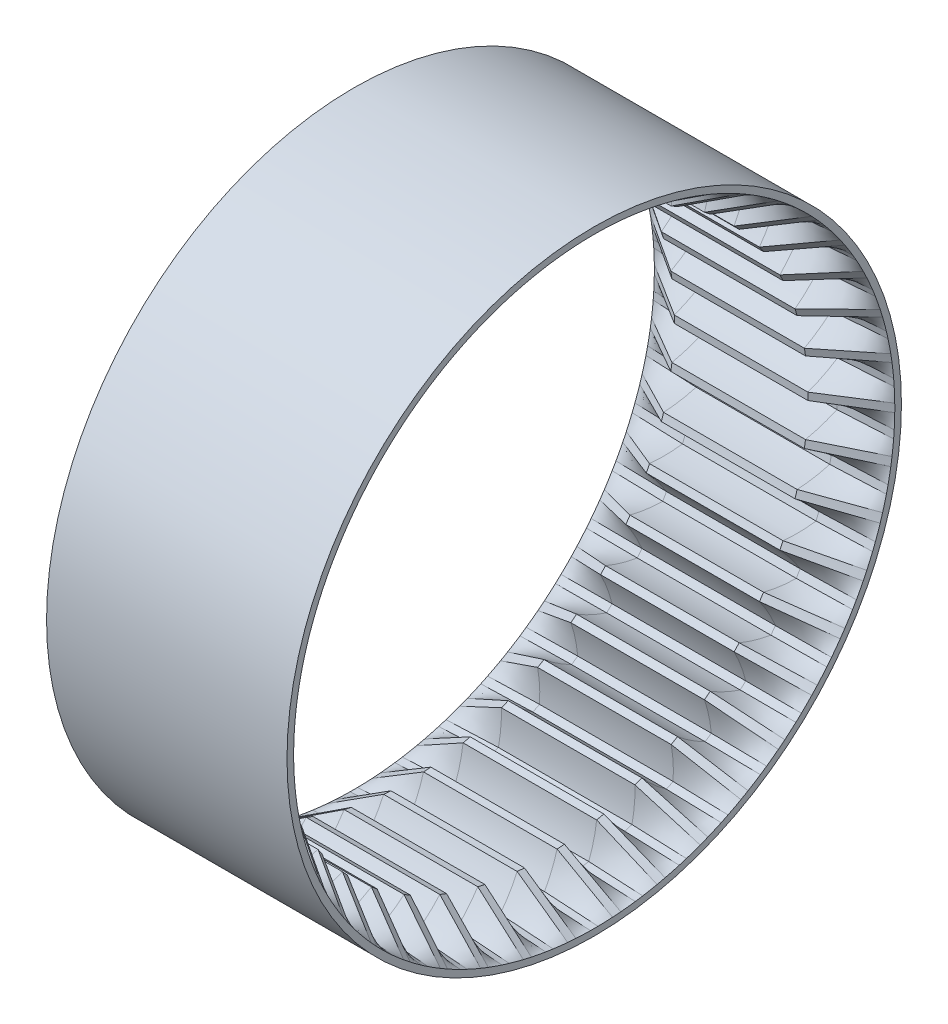
from build123d import *

# Parameters (mm, degrees)
INTERNAL_START                  = -31.817093457
INTERNAL_SPUR_GEAR_AM_OUTLINE_R = 11.5
INTERNAL_SPUR_GEAR_AM_DEPTH     = 5
SKETCH1_R                       = 11.5
SKETCH2_R                       = 11.5
SKETCH2_4_R                     = 11.25


# Read off the part's stored shape, not the designer's step: internal spur gear_am
with BuildPart() as part:
    # internal spur gear_am outline → internal spur gear_am (new body)
    with BuildSketch(Plane.YZ.offset(INTERNAL_START)):
        with Locations((-14.172206763, 26.417834689)):
            Circle(INTERNAL_SPUR_GEAR_AM_OUTLINE_R)
        with BuildLine():
            ThreePointArc((-3.04709591, 26.277177283), (-3.605096525, 26.008397418), (-4.190867754, 25.807202565))
            ThreePointArc((-4.190867754, 25.807202565), (-4.200168791, 25.670533753), (-4.211341069, 25.534005171))
            ThreePointArc((-4.211341069, 25.534005171), (-3.662098957, 25.247752827), (-3.150390308, 24.898809335))
            ThreePointArc((-3.150390308, 24.898809335), (-3.170474991, 24.759590436), (-3.192318105, 24.620636577))
            ThreePointArc((-3.192318105, 24.620636577), (-3.784145874, 24.438024437), (-4.39336106, 24.326381436))
            ThreePointArc((-4.39336106, 24.326381436), (-4.422927641, 24.192625349), (-4.454323663, 24.059286821))
            ThreePointArc((-4.454323663, 24.059286821), (-3.953879829, 23.69437139), (-3.499893872, 23.273059091))
            ThreePointArc((-3.499893872, 23.273059091), (-3.540503726, 23.138388618), (-3.582812869, 23.004242307))
            ThreePointArc((-3.582812869, 23.004242307), (-4.195247338, 22.911877145), (-4.814297619, 22.892279916))
            ThreePointArc((-4.814297619, 22.892279916), (-4.863469277, 22.764424445), (-4.914387707, 22.637254532))
            ThreePointArc((-4.914387707, 22.637254532), (-4.47392124, 22.201827622), (-4.087799271, 21.717557937))
            ThreePointArc((-4.087799271, 21.717557937), (-4.148027139, 21.590444207), (-4.209857194, 21.46410205))
            ThreePointArc((-4.209857194, 21.46410205), (-4.829217589, 21.464047152), (-5.444274405, 21.536933465))
            ThreePointArc((-5.444274405, 21.536933465), (-5.511952725, 21.417834689), (-5.581256131, 21.299674157))
            ThreePointArc((-5.581256131, 21.299674157), (-5.210606324, 20.803462485), (-4.90097367, 20.2670532))
            ThreePointArc((-4.90097367, 20.2670532), (-4.97947416, 20.150335723), (-5.059443946, 20.034619995))
            ThreePointArc((-5.059443946, 20.034619995), (-5.671894779, 20.126876587), (-6.269218778, 20.290618281))
            ThreePointArc((-6.269218778, 20.290618281), (-6.353891939, 20.18293667), (-6.440032196, 20.07642503))
            ThreePointArc((-6.440032196, 20.07642503), (-6.147478753, 19.530513146), (-5.921252095, 18.953946756))
            ThreePointArc((-5.921252095, 18.953946756), (-6.016271637, 18.850232808), (-6.112594761, 18.747728407))
            ThreePointArc((-6.112594761, 18.747728407), (-6.704454893, 18.93023563), (-7.270702843, 19.181174987))
            ThreePointArc((-7.270702843, 19.181174987), (-7.370479386, 19.087315971), (-7.471532264, 18.994832517))
            ThreePointArc((-7.471532264, 18.994832517), (-7.263610346, 18.411415189), (-7.125843214, 17.807571236))
            ThreePointArc((-7.125843214, 17.807571236), (-7.235259228, 17.719177615), (-7.34578399, 17.63217432))
            ThreePointArc((-7.34578399, 17.63217432), (-7.903832243, 17.900855263), (-8.426355101, 18.233386713))
            ThreePointArc((-8.426355101, 18.233386713), (-8.539006183, 18.155446946), (-8.652714327, 18.079057605))
            ThreePointArc((-8.652714327, 18.079057605), (-8.534068566, 17.471167413), (-8.48783845, 16.853534773))
            ThreePointArc((-8.48783845, 16.853534773), (-8.609206763, 16.782436046), (-8.731464223, 16.712877367))
            ThreePointArc((-8.731464223, 16.712877367), (-9.243234722, 17.061730142), (-9.710360191, 17.468425481))
            ThreePointArc((-9.710360191, 17.468425481), (-9.833369372, 17.40814601), (-9.957192731, 17.349557195))
            ThreePointArc((-9.957192731, 17.349557195), (-9.930473477, 16.730773401), (-9.976813081, 16.113148966))
            ThreePointArc((-9.976813081, 16.113148966), (-10.107422526, 16.060933362), (-10.238681654, 16.010373124))
            ThreePointArc((-10.238681654, 16.010373124), (-10.692742292, 16.431604937), (-11.094035559, 16.903379264))
            ThreePointArc((-11.094035559, 16.903379264), (-11.224655019, 16.862106631), (-11.355827583, 16.822627119))
            ThreePointArc((-11.355827583, 16.822627119), (-11.4216317, 16.20677233), (-11.559505875, 15.602952809))
            ThreePointArc((-11.559505875, 15.602952809), (-11.696438852, 15.570786738), (-11.833767537, 15.540354375))
            ThreePointArc((-11.833767537, 15.540354375), (-12.219975348, 16.024555602), (-12.546472187, 16.550870258))
            ThreePointArc((-12.546472187, 16.550870258), (-12.681784102, 16.529526427), (-12.817375692, 16.510038124))
            ThreePointArc((-12.817375692, 16.510038124), (-12.974233224, 15.910869519), (-13.200562089, 15.334343243))
            ThreePointArc((-13.200562089, 15.334343243), (-13.340759742, 15.322945241), (-13.481090287, 15.313320561))
            ThreePointArc((-13.481090287, 15.313320561), (-13.790818028, 15.849674948), (-14.035225038, 16.418772933))
            ThreePointArc((-14.035225038, 16.418772933), (-14.172206764, 16.417834689), (-14.309188489, 16.418772933))
            ThreePointArc((-14.309188489, 16.418772933), (-14.553595499, 15.849674949), (-14.863323239, 15.313320561))
            ThreePointArc((-14.863323239, 15.313320561), (-15.003653784, 15.322945241), (-15.143851437, 15.334343243))
            ThreePointArc((-15.143851437, 15.334343243), (-15.370180302, 15.910869519), (-15.527037834, 16.510038124))
            ThreePointArc((-15.527037834, 16.510038124), (-15.662629425, 16.529526427), (-15.79794134, 16.550870258))
            ThreePointArc((-15.79794134, 16.550870258), (-16.124438179, 16.024555602), (-16.51064599, 15.540354375))
            ThreePointArc((-16.51064599, 15.540354375), (-16.647974674, 15.570786738), (-16.784907651, 15.602952809))
            ThreePointArc((-16.784907651, 15.602952809), (-16.922781827, 16.20677233), (-16.988585943, 16.822627119))
            ThreePointArc((-16.988585943, 16.822627119), (-17.119758507, 16.862106631), (-17.250377967, 16.903379264))
            ThreePointArc((-17.250377967, 16.903379264), (-17.651671235, 16.431604937), (-18.105731872, 16.010373124))
            ThreePointArc((-18.105731872, 16.010373124), (-18.236991, 16.060933362), (-18.367600445, 16.113148966))
            ThreePointArc((-18.367600445, 16.113148966), (-18.41394005, 16.730773401), (-18.387220796, 17.349557195))
            ThreePointArc((-18.387220796, 17.349557195), (-18.511044154, 17.40814601), (-18.634053336, 17.468425481))
            ThreePointArc((-18.634053336, 17.468425481), (-19.101178804, 17.061730142), (-19.612949303, 16.712877367))
            ThreePointArc((-19.612949303, 16.712877367), (-19.735206763, 16.782436046), (-19.856575076, 16.853534773))
            ThreePointArc((-19.856575076, 16.853534773), (-19.810344961, 17.471167413), (-19.691699199, 18.079057605))
            ThreePointArc((-19.691699199, 18.079057605), (-19.805407344, 18.155446946), (-19.918058425, 18.233386713))
            ThreePointArc((-19.918058425, 18.233386713), (-20.440581283, 17.900855263), (-20.998629537, 17.63217432))
            ThreePointArc((-20.998629537, 17.63217432), (-21.109154299, 17.719177615), (-21.218570313, 17.807571236))
            ThreePointArc((-21.218570313, 17.807571236), (-21.080803181, 18.411415189), (-20.872881263, 18.994832517))
            ThreePointArc((-20.872881263, 18.994832517), (-20.973934141, 19.087315971), (-21.073710683, 19.181174987))
            ThreePointArc((-21.073710683, 19.181174987), (-21.639958634, 18.93023563), (-22.231818766, 18.747728407))
            ThreePointArc((-22.231818766, 18.747728407), (-22.328141889, 18.850232808), (-22.423161431, 18.953946756))
            ThreePointArc((-22.423161431, 18.953946756), (-22.196934773, 19.530513146), (-21.904381331, 20.07642503))
            ThreePointArc((-21.904381331, 20.07642503), (-21.990521588, 20.18293667), (-22.075194748, 20.290618281))
            ThreePointArc((-22.075194748, 20.290618281), (-22.672518747, 20.126876587), (-23.284969581, 20.034619995))
            ThreePointArc((-23.284969581, 20.034619995), (-23.364939366, 20.150335723), (-23.443439857, 20.2670532))
            ThreePointArc((-23.443439857, 20.2670532), (-23.133807202, 20.803462485), (-22.763157395, 21.299674157))
            ThreePointArc((-22.763157395, 21.299674157), (-22.832460801, 21.417834689), (-22.900139121, 21.536933465))
            ThreePointArc((-22.900139121, 21.536933465), (-23.515195938, 21.464047152), (-24.134556333, 21.46410205))
            ThreePointArc((-24.134556333, 21.46410205), (-24.196386387, 21.590444207), (-24.256614255, 21.717557937))
            ThreePointArc((-24.256614255, 21.717557937), (-23.870492286, 22.201827622), (-23.430025819, 22.637254532))
            ThreePointArc((-23.430025819, 22.637254532), (-23.48094425, 22.764424445), (-23.530115907, 22.892279916))
            ThreePointArc((-23.530115907, 22.892279916), (-24.149166189, 22.911877145), (-24.761600658, 23.004242307))
            ThreePointArc((-24.761600658, 23.004242307), (-24.8039098, 23.138388618), (-24.844519654, 23.273059091))
            ThreePointArc((-24.844519654, 23.273059091), (-24.390533697, 23.69437139), (-23.890089864, 24.059286821))
            ThreePointArc((-23.890089864, 24.059286821), (-23.921485885, 24.19262535), (-23.951052467, 24.326381436))
            ThreePointArc((-23.951052467, 24.326381436), (-24.560267652, 24.438024437), (-25.152095421, 24.620636577))
            ThreePointArc((-25.152095421, 24.620636577), (-25.173938536, 24.759590435), (-25.194023218, 24.898809335))
            ThreePointArc((-25.194023218, 24.898809335), (-24.68231457, 25.247752827), (-24.133072458, 25.534005171))
            ThreePointArc((-24.133072458, 25.534005171), (-24.144244735, 25.670533753), (-24.153545772, 25.807202565))
            ThreePointArc((-24.153545772, 25.807202565), (-24.739317001, 26.008397418), (-25.297317616, 26.277177283))
            ThreePointArc((-25.297317616, 26.277177283), (-25.298206763, 26.417834689), (-25.297317616, 26.558492095))
            ThreePointArc((-25.297317616, 26.558492095), (-24.739317001, 26.82727196), (-24.153545772, 27.028466813))
            ThreePointArc((-24.153545772, 27.028466813), (-24.144244735, 27.165135625), (-24.133072458, 27.301664207))
            ThreePointArc((-24.133072458, 27.301664207), (-24.68231457, 27.587916551), (-25.194023218, 27.936860043))
            ThreePointArc((-25.194023218, 27.936860043), (-25.173938536, 28.076078943), (-25.152095421, 28.215032801))
            ThreePointArc((-25.152095421, 28.215032801), (-24.560267652, 28.397644941), (-23.951052467, 28.509287942))
            ThreePointArc((-23.951052467, 28.509287942), (-23.921485885, 28.643044028), (-23.890089864, 28.776382557))
            ThreePointArc((-23.890089864, 28.776382557), (-24.390533697, 29.141297988), (-24.844519654, 29.562610287))
            ThreePointArc((-24.844519654, 29.562610287), (-24.8039098, 29.697280759), (-24.761600658, 29.831427071))
            ThreePointArc((-24.761600658, 29.831427071), (-24.149166188, 29.923792232), (-23.530115907, 29.943389461))
            ThreePointArc((-23.530115907, 29.943389461), (-23.48094425, 30.071244933), (-23.430025819, 30.198414846))
            ThreePointArc((-23.430025819, 30.198414846), (-23.870492286, 30.633841756), (-24.256614255, 31.11811144))
            ThreePointArc((-24.256614255, 31.11811144), (-24.196386387, 31.24522517), (-24.134556333, 31.371567327))
            ThreePointArc((-24.134556333, 31.371567327), (-23.515195938, 31.371622226), (-22.900139121, 31.298735913))
            ThreePointArc((-22.900139121, 31.298735913), (-22.832460801, 31.417834689), (-22.763157395, 31.535995221))
            ThreePointArc((-22.763157395, 31.535995221), (-23.133807202, 32.032206893), (-23.443439857, 32.568616178))
            ThreePointArc((-23.443439857, 32.568616178), (-23.364939366, 32.685333655), (-23.284969581, 32.801049383))
            ThreePointArc((-23.284969581, 32.801049383), (-22.672518747, 32.708792791), (-22.075194748, 32.545051097))
            ThreePointArc((-22.075194748, 32.545051097), (-21.990521588, 32.652732708), (-21.904381331, 32.759244348))
            ThreePointArc((-21.904381331, 32.759244348), (-22.196934773, 33.305156232), (-22.423161431, 33.881722621))
            ThreePointArc((-22.423161431, 33.881722621), (-22.328141889, 33.985436569), (-22.231818766, 34.08794097))
            ThreePointArc((-22.231818766, 34.08794097), (-21.639958634, 33.905433748), (-21.073710683, 33.654494391))
            ThreePointArc((-21.073710683, 33.654494391), (-20.973934141, 33.748353407), (-20.872881263, 33.840836861))
            ThreePointArc((-20.872881263, 33.840836861), (-21.080803181, 34.424254189), (-21.218570313, 35.028098142))
            ThreePointArc((-21.218570313, 35.028098142), (-21.109154299, 35.116491763), (-20.998629537, 35.203495058))
            ThreePointArc((-20.998629537, 35.203495058), (-20.440581283, 34.934814115), (-19.918058425, 34.602282665))
            ThreePointArc((-19.918058425, 34.602282665), (-19.805407344, 34.680222432), (-19.691699199, 34.756611772))
            ThreePointArc((-19.691699199, 34.756611772), (-19.810344961, 35.364501964), (-19.856575076, 35.982134605))
            ThreePointArc((-19.856575076, 35.982134605), (-19.735206763, 36.053233331), (-19.612949303, 36.12279201))
            ThreePointArc((-19.612949303, 36.12279201), (-19.101178804, 35.773939236), (-18.634053336, 35.367243896))
            ThreePointArc((-18.634053336, 35.367243896), (-18.511044155, 35.427523368), (-18.387220796, 35.486112183))
            ThreePointArc((-18.387220796, 35.486112183), (-18.41394005, 36.104895977), (-18.367600445, 36.722520412))
            ThreePointArc((-18.367600445, 36.722520412), (-18.236991, 36.774736016), (-18.105731872, 36.825296254))
            ThreePointArc((-18.105731872, 36.825296254), (-17.651671235, 36.404064441), (-17.250377967, 35.932290114))
            ThreePointArc((-17.250377967, 35.932290114), (-17.119758507, 35.973562747), (-16.988585943, 36.013042259))
            ThreePointArc((-16.988585943, 36.013042259), (-16.922781827, 36.628897047), (-16.784907651, 37.232716568))
            ThreePointArc((-16.784907651, 37.232716568), (-16.647974674, 37.26488264), (-16.51064599, 37.295315003))
            ThreePointArc((-16.51064599, 37.295315003), (-16.124438179, 36.811113775), (-15.79794134, 36.28479912))
            ThreePointArc((-15.79794134, 36.28479912), (-15.662629425, 36.306142951), (-15.527037834, 36.325631254))
            ThreePointArc((-15.527037834, 36.325631254), (-15.370180302, 36.924799859), (-15.143851437, 37.501326135))
            ThreePointArc((-15.143851437, 37.501326135), (-15.003653784, 37.512724136), (-14.863323239, 37.522348817))
            ThreePointArc((-14.863323239, 37.522348817), (-14.553595499, 36.985994429), (-14.309188489, 36.416896445))
            ThreePointArc((-14.309188489, 36.416896445), (-14.172206764, 36.417834689), (-14.035225038, 36.416896445))
            ThreePointArc((-14.035225038, 36.416896445), (-13.790818028, 36.98599443), (-13.481090287, 37.522348817))
            ThreePointArc((-13.481090287, 37.522348817), (-13.340759742, 37.512724136), (-13.200562089, 37.501326135))
            ThreePointArc((-13.200562089, 37.501326135), (-12.974233224, 36.924799859), (-12.817375692, 36.325631254))
            ThreePointArc((-12.817375692, 36.325631254), (-12.681784102, 36.306142951), (-12.546472187, 36.28479912))
            ThreePointArc((-12.546472187, 36.28479912), (-12.219975348, 36.811113775), (-11.833767537, 37.295315003))
            ThreePointArc((-11.833767537, 37.295315003), (-11.696438852, 37.26488264), (-11.559505875, 37.232716568))
            ThreePointArc((-11.559505875, 37.232716568), (-11.4216317, 36.628897047), (-11.355827583, 36.013042259))
            ThreePointArc((-11.355827583, 36.013042259), (-11.224655019, 35.973562747), (-11.094035559, 35.932290114))
            ThreePointArc((-11.094035559, 35.932290114), (-10.692742292, 36.404064441), (-10.238681654, 36.825296254))
            ThreePointArc((-10.238681654, 36.825296254), (-10.107422526, 36.774736016), (-9.976813081, 36.722520412))
            ThreePointArc((-9.976813081, 36.722520412), (-9.930473477, 36.104895977), (-9.957192731, 35.486112183))
            ThreePointArc((-9.957192731, 35.486112183), (-9.833369372, 35.427523368), (-9.710360191, 35.367243896))
            ThreePointArc((-9.710360191, 35.367243896), (-9.243234723, 35.773939236), (-8.731464223, 36.12279201))
            ThreePointArc((-8.731464223, 36.12279201), (-8.609206763, 36.053233331), (-8.48783845, 35.982134605))
            ThreePointArc((-8.48783845, 35.982134605), (-8.534068566, 35.364501964), (-8.652714327, 34.756611772))
            ThreePointArc((-8.652714327, 34.756611772), (-8.539006183, 34.680222432), (-8.426355101, 34.602282665))
            ThreePointArc((-8.426355101, 34.602282665), (-7.903832243, 34.934814115), (-7.34578399, 35.203495058))
            ThreePointArc((-7.34578399, 35.203495058), (-7.235259228, 35.116491763), (-7.125843214, 35.028098142))
            ThreePointArc((-7.125843214, 35.028098142), (-7.263610346, 34.424254189), (-7.471532264, 33.840836861))
            ThreePointArc((-7.471532264, 33.840836861), (-7.370479386, 33.748353407), (-7.270702843, 33.654494391))
            ThreePointArc((-7.270702843, 33.654494391), (-6.704454893, 33.905433748), (-6.112594761, 34.08794097))
            ThreePointArc((-6.112594761, 34.08794097), (-6.016271637, 33.985436569), (-5.921252095, 33.881722621))
            ThreePointArc((-5.921252095, 33.881722621), (-6.147478753, 33.305156232), (-6.440032196, 32.759244348))
            ThreePointArc((-6.440032196, 32.759244348), (-6.353891939, 32.652732708), (-6.269218778, 32.545051097))
            ThreePointArc((-6.269218778, 32.545051097), (-5.671894779, 32.708792791), (-5.059443946, 32.801049383))
            ThreePointArc((-5.059443946, 32.801049383), (-4.97947416, 32.685333655), (-4.90097367, 32.568616178))
            ThreePointArc((-4.90097367, 32.568616178), (-5.210606324, 32.032206893), (-5.581256131, 31.535995221))
            ThreePointArc((-5.581256131, 31.535995221), (-5.511952725, 31.417834689), (-5.444274405, 31.298735913))
            ThreePointArc((-5.444274405, 31.298735913), (-4.829217589, 31.371622226), (-4.209857194, 31.371567327))
            ThreePointArc((-4.209857194, 31.371567327), (-4.148027139, 31.24522517), (-4.087799271, 31.11811144))
            ThreePointArc((-4.087799271, 31.11811144), (-4.47392124, 30.633841756), (-4.914387707, 30.198414846))
            ThreePointArc((-4.914387707, 30.198414846), (-4.863469277, 30.071244932), (-4.814297619, 29.943389461))
            ThreePointArc((-4.814297619, 29.943389461), (-4.195247338, 29.923792232), (-3.582812869, 29.831427071))
            ThreePointArc((-3.582812869, 29.831427071), (-3.540503726, 29.69728076), (-3.499893872, 29.562610287))
            ThreePointArc((-3.499893872, 29.562610287), (-3.953879829, 29.141297988), (-4.454323663, 28.776382557))
            ThreePointArc((-4.454323663, 28.776382557), (-4.422927641, 28.643044028), (-4.39336106, 28.509287942))
            ThreePointArc((-4.39336106, 28.509287942), (-3.784145874, 28.397644941), (-3.192318105, 28.215032801))
            ThreePointArc((-3.192318105, 28.215032801), (-3.170474991, 28.076078942), (-3.150390308, 27.936860043))
            ThreePointArc((-3.150390308, 27.936860043), (-3.662098957, 27.587916551), (-4.211341069, 27.301664207))
            ThreePointArc((-4.211341069, 27.301664207), (-4.200168791, 27.165135625), (-4.190867754, 27.028466813))
            ThreePointArc((-4.190867754, 27.028466813), (-3.605096525, 26.82727196), (-3.04709591, 26.558492095))
            ThreePointArc((-3.04709591, 26.558492095), (-3.046206763, 26.417834689), (-3.04709591, 26.277177283))
        make_face(mode=Mode.SUBTRACT)
    extrude(amount=INTERNAL_SPUR_GEAR_AM_DEPTH)

    # Sketch1 → Loft1 section 0
    with BuildSketch(Plane(origin=(-26.817093457, 0, 0), x_dir=(0, 0, -1), z_dir=(1, 0, 0))):
        with Locations((-26.417834689, -14.172206763)):
            Circle(SKETCH1_R)
    # Sketch2 → Loft1 section 1
    with BuildSketch(Plane(origin=(-24.817093457, 0, 0), x_dir=(0, 0, -1), z_dir=(1, 0, 0))):
        with Locations((-26.417834689, -14.172206763)):
            Circle(SKETCH2_R)
    loft1 = loft()

    # Sketch1<4> → Cut-Loft2 section 0
    with BuildSketch(Plane(origin=(-26.817093457, 0, 0), x_dir=(0, 0, -1), z_dir=(1, 0, 0))):
        with BuildLine():
            ThreePointArc((-23.004242307, -3.582812869), (-23.138388618, -3.540503726), (-23.273059091, -3.499893872))
            ThreePointArc((-23.273059091, -3.499893872), (-23.69437139, -3.953879829), (-24.059286821, -4.454323663))
            ThreePointArc((-24.059286821, -4.454323663), (-24.192625349, -4.422927641), (-24.326381436, -4.39336106))
            ThreePointArc((-24.326381436, -4.39336106), (-24.438024437, -3.784145874), (-24.620636577, -3.192318105))
            ThreePointArc((-24.620636577, -3.192318105), (-24.759590435, -3.170474991), (-24.898809335, -3.150390308))
            ThreePointArc((-24.898809335, -3.150390308), (-25.247752827, -3.662098957), (-25.534005171, -4.211341069))
            ThreePointArc((-25.534005171, -4.211341069), (-25.670533753, -4.200168791), (-25.807202565, -4.190867754))
            ThreePointArc((-25.807202565, -4.190867754), (-26.008397418, -3.605096525), (-26.277177283, -3.04709591))
            ThreePointArc((-26.277177283, -3.04709591), (-26.417834689, -3.046206763), (-26.558492095, -3.04709591))
            ThreePointArc((-26.558492095, -3.04709591), (-26.82727196, -3.605096525), (-27.028466813, -4.190867754))
            ThreePointArc((-27.028466813, -4.190867754), (-27.165135625, -4.200168791), (-27.301664207, -4.211341069))
            ThreePointArc((-27.301664207, -4.211341069), (-27.587916551, -3.662098957), (-27.936860043, -3.150390308))
            ThreePointArc((-27.936860043, -3.150390308), (-28.076078942, -3.170474991), (-28.215032801, -3.192318105))
            ThreePointArc((-28.215032801, -3.192318105), (-28.397644941, -3.784145874), (-28.509287942, -4.39336106))
            ThreePointArc((-28.509287942, -4.39336106), (-28.643044028, -4.422927641), (-28.776382557, -4.454323663))
            ThreePointArc((-28.776382557, -4.454323663), (-29.141297988, -3.953879829), (-29.562610287, -3.499893872))
            ThreePointArc((-29.562610287, -3.499893872), (-29.697280759, -3.540503726), (-29.831427071, -3.582812869))
            ThreePointArc((-29.831427071, -3.582812869), (-29.923792232, -4.195247338), (-29.943389461, -4.814297619))
            ThreePointArc((-29.943389461, -4.814297619), (-30.071244933, -4.863469277), (-30.198414846, -4.914387707))
            ThreePointArc((-30.198414846, -4.914387707), (-30.633841756, -4.47392124), (-31.11811144, -4.087799271))
            ThreePointArc((-31.11811144, -4.087799271), (-31.24522517, -4.148027139), (-31.371567327, -4.209857194))
            ThreePointArc((-31.371567327, -4.209857194), (-31.371622226, -4.829217589), (-31.298735913, -5.444274405))
            ThreePointArc((-31.298735913, -5.444274405), (-31.417834689, -5.511952725), (-31.535995221, -5.581256131))
            ThreePointArc((-31.535995221, -5.581256131), (-32.032206893, -5.210606324), (-32.568616178, -4.90097367))
            ThreePointArc((-32.568616178, -4.90097367), (-32.685333655, -4.97947416), (-32.801049383, -5.059443946))
            ThreePointArc((-32.801049383, -5.059443946), (-32.708792791, -5.671894779), (-32.545051097, -6.269218778))
            ThreePointArc((-32.545051097, -6.269218778), (-32.652732708, -6.353891939), (-32.759244348, -6.440032196))
            ThreePointArc((-32.759244348, -6.440032196), (-33.305156232, -6.147478753), (-33.881722621, -5.921252095))
            ThreePointArc((-33.881722621, -5.921252095), (-33.985436569, -6.016271637), (-34.08794097, -6.112594761))
            ThreePointArc((-34.08794097, -6.112594761), (-33.905433748, -6.704454893), (-33.654494391, -7.270702843))
            ThreePointArc((-33.654494391, -7.270702843), (-33.748353407, -7.370479385), (-33.840836861, -7.471532264))
            ThreePointArc((-33.840836861, -7.471532264), (-34.424254189, -7.263610346), (-35.028098142, -7.125843214))
            ThreePointArc((-35.028098142, -7.125843214), (-35.116491763, -7.235259228), (-35.203495058, -7.34578399))
            ThreePointArc((-35.203495058, -7.34578399), (-34.934814115, -7.903832243), (-34.602282665, -8.426355101))
            ThreePointArc((-34.602282665, -8.426355101), (-34.680222432, -8.539006183), (-34.756611772, -8.652714327))
            ThreePointArc((-34.756611772, -8.652714327), (-35.364501964, -8.534068566), (-35.982134605, -8.48783845))
            ThreePointArc((-35.982134605, -8.48783845), (-36.053233331, -8.609206763), (-36.12279201, -8.731464223))
            ThreePointArc((-36.12279201, -8.731464223), (-35.773939236, -9.243234722), (-35.367243896, -9.710360191))
            ThreePointArc((-35.367243896, -9.710360191), (-35.427523368, -9.833369372), (-35.486112183, -9.957192731))
            ThreePointArc((-35.486112183, -9.957192731), (-36.104895977, -9.930473477), (-36.722520412, -9.976813081))
            ThreePointArc((-36.722520412, -9.976813081), (-36.774736016, -10.107422526), (-36.825296254, -10.238681654))
            ThreePointArc((-36.825296254, -10.238681654), (-36.404064441, -10.692742292), (-35.932290114, -11.094035559))
            ThreePointArc((-35.932290114, -11.094035559), (-35.973562747, -11.224655019), (-36.013042259, -11.355827583))
            ThreePointArc((-36.013042259, -11.355827583), (-36.628897047, -11.4216317), (-37.232716568, -11.559505875))
            ThreePointArc((-37.232716568, -11.559505875), (-37.26488264, -11.696438852), (-37.295315003, -11.833767537))
            ThreePointArc((-37.295315003, -11.833767537), (-36.811113775, -12.219975348), (-36.28479912, -12.546472187))
            ThreePointArc((-36.28479912, -12.546472187), (-36.306142951, -12.681784101), (-36.325631254, -12.817375692))
            ThreePointArc((-36.325631254, -12.817375692), (-36.924799858, -12.974233224), (-37.501326135, -13.200562089))
            ThreePointArc((-37.501326135, -13.200562089), (-37.512724136, -13.340759742), (-37.522348817, -13.481090287))
            ThreePointArc((-37.522348817, -13.481090287), (-36.98599443, -13.790818028), (-36.416896445, -14.035225038))
            ThreePointArc((-36.416896445, -14.035225038), (-36.417834689, -14.172206763), (-36.416896445, -14.309188489))
            ThreePointArc((-36.416896445, -14.309188489), (-36.98599443, -14.553595499), (-37.522348817, -14.863323239))
            ThreePointArc((-37.522348817, -14.863323239), (-37.512724136, -15.003653784), (-37.501326135, -15.143851437))
            ThreePointArc((-37.501326135, -15.143851437), (-36.924799858, -15.370180302), (-36.325631254, -15.527037834))
            ThreePointArc((-36.325631254, -15.527037834), (-36.306142951, -15.662629425), (-36.28479912, -15.79794134))
            ThreePointArc((-36.28479912, -15.79794134), (-36.811113775, -16.124438179), (-37.295315003, -16.51064599))
            ThreePointArc((-37.295315003, -16.51064599), (-37.26488264, -16.647974674), (-37.232716568, -16.784907651))
            ThreePointArc((-37.232716568, -16.784907651), (-36.628897047, -16.922781827), (-36.013042259, -16.988585943))
            ThreePointArc((-36.013042259, -16.988585943), (-35.973562747, -17.119758507), (-35.932290114, -17.250377967))
            ThreePointArc((-35.932290114, -17.250377967), (-36.404064441, -17.651671235), (-36.825296254, -18.105731872))
            ThreePointArc((-36.825296254, -18.105731872), (-36.774736016, -18.236991), (-36.722520412, -18.367600445))
            ThreePointArc((-36.722520412, -18.367600445), (-36.104895977, -18.41394005), (-35.486112183, -18.387220796))
            ThreePointArc((-35.486112183, -18.387220796), (-35.427523368, -18.511044154), (-35.367243896, -18.634053336))
            ThreePointArc((-35.367243896, -18.634053336), (-35.773939236, -19.101178804), (-36.12279201, -19.612949303))
            ThreePointArc((-36.12279201, -19.612949303), (-36.053233331, -19.735206763), (-35.982134605, -19.856575076))
            ThreePointArc((-35.982134605, -19.856575076), (-35.364501964, -19.810344961), (-34.756611772, -19.691699199))
            ThreePointArc((-34.756611772, -19.691699199), (-34.680222432, -19.805407344), (-34.602282665, -19.918058425))
            ThreePointArc((-34.602282665, -19.918058425), (-34.934814115, -20.440581283), (-35.203495058, -20.998629537))
            ThreePointArc((-35.203495058, -20.998629537), (-35.116491763, -21.109154299), (-35.028098142, -21.218570313))
            ThreePointArc((-35.028098142, -21.218570313), (-34.424254189, -21.080803181), (-33.840836861, -20.872881263))
            ThreePointArc((-33.840836861, -20.872881263), (-33.748353407, -20.973934141), (-33.654494391, -21.073710683))
            ThreePointArc((-33.654494391, -21.073710683), (-33.905433748, -21.639958634), (-34.08794097, -22.231818766))
            ThreePointArc((-34.08794097, -22.231818766), (-33.985436569, -22.328141889), (-33.881722621, -22.423161431))
            ThreePointArc((-33.881722621, -22.423161431), (-33.305156232, -22.196934773), (-32.759244348, -21.904381331))
            ThreePointArc((-32.759244348, -21.904381331), (-32.652732708, -21.990521588), (-32.545051097, -22.075194748))
            ThreePointArc((-32.545051097, -22.075194748), (-32.708792791, -22.672518747), (-32.801049383, -23.284969581))
            ThreePointArc((-32.801049383, -23.284969581), (-32.685333655, -23.364939366), (-32.568616178, -23.443439857))
            ThreePointArc((-32.568616178, -23.443439857), (-32.032206893, -23.133807202), (-31.535995221, -22.763157395))
            ThreePointArc((-31.535995221, -22.763157395), (-31.417834689, -22.832460801), (-31.298735913, -22.900139121))
            ThreePointArc((-31.298735913, -22.900139121), (-31.371622226, -23.515195938), (-31.371567327, -24.134556333))
            ThreePointArc((-31.371567327, -24.134556333), (-31.24522517, -24.196386387), (-31.11811144, -24.256614255))
            ThreePointArc((-31.11811144, -24.256614255), (-30.633841756, -23.870492286), (-30.198414846, -23.430025819))
            ThreePointArc((-30.198414846, -23.430025819), (-30.071244933, -23.48094425), (-29.943389461, -23.530115907))
            ThreePointArc((-29.943389461, -23.530115907), (-29.923792232, -24.149166188), (-29.831427071, -24.761600658))
            ThreePointArc((-29.831427071, -24.761600658), (-29.697280759, -24.8039098), (-29.562610287, -24.844519654))
            ThreePointArc((-29.562610287, -24.844519654), (-29.141297988, -24.390533697), (-28.776382557, -23.890089864))
            ThreePointArc((-28.776382557, -23.890089864), (-28.643044028, -23.921485885), (-28.509287942, -23.951052467))
            ThreePointArc((-28.509287942, -23.951052467), (-28.397644941, -24.560267652), (-28.215032801, -25.152095421))
            ThreePointArc((-28.215032801, -25.152095421), (-28.076078942, -25.173938536), (-27.936860043, -25.194023218))
            ThreePointArc((-27.936860043, -25.194023218), (-27.587916551, -24.68231457), (-27.301664207, -24.133072458))
            ThreePointArc((-27.301664207, -24.133072458), (-27.165135625, -24.144244735), (-27.028466813, -24.153545772))
            ThreePointArc((-27.028466813, -24.153545772), (-26.82727196, -24.739317002), (-26.558492095, -25.297317616))
            ThreePointArc((-26.558492095, -25.297317616), (-26.417834689, -25.298206763), (-26.277177283, -25.297317616))
            ThreePointArc((-26.277177283, -25.297317616), (-26.008397418, -24.739317002), (-25.807202565, -24.153545772))
            ThreePointArc((-25.807202565, -24.153545772), (-25.670533753, -24.144244735), (-25.534005171, -24.133072458))
            ThreePointArc((-25.534005171, -24.133072458), (-25.247752827, -24.68231457), (-24.898809335, -25.194023218))
            ThreePointArc((-24.898809335, -25.194023218), (-24.759590435, -25.173938536), (-24.620636577, -25.152095421))
            ThreePointArc((-24.620636577, -25.152095421), (-24.438024437, -24.560267652), (-24.326381436, -23.951052467))
            ThreePointArc((-24.326381436, -23.951052467), (-24.192625349, -23.921485885), (-24.059286821, -23.890089864))
            ThreePointArc((-24.059286821, -23.890089864), (-23.69437139, -24.390533697), (-23.273059091, -24.844519654))
            ThreePointArc((-23.273059091, -24.844519654), (-23.138388618, -24.8039098), (-23.004242307, -24.761600658))
            ThreePointArc((-23.004242307, -24.761600658), (-22.911877145, -24.149166188), (-22.892279916, -23.530115907))
            ThreePointArc((-22.892279916, -23.530115907), (-22.764424445, -23.48094425), (-22.637254532, -23.430025819))
            ThreePointArc((-22.637254532, -23.430025819), (-22.201827622, -23.870492286), (-21.717557937, -24.256614255))
            ThreePointArc((-21.717557937, -24.256614255), (-21.590444207, -24.196386387), (-21.46410205, -24.134556333))
            ThreePointArc((-21.46410205, -24.134556333), (-21.464047152, -23.515195938), (-21.536933465, -22.900139121))
            ThreePointArc((-21.536933465, -22.900139121), (-21.417834689, -22.832460801), (-21.299674157, -22.763157395))
            ThreePointArc((-21.299674157, -22.763157395), (-20.803462485, -23.133807202), (-20.2670532, -23.443439857))
            ThreePointArc((-20.2670532, -23.443439857), (-20.150335723, -23.364939366), (-20.034619995, -23.284969581))
            ThreePointArc((-20.034619995, -23.284969581), (-20.126876587, -22.672518747), (-20.290618281, -22.075194748))
            ThreePointArc((-20.290618281, -22.075194748), (-20.18293667, -21.990521588), (-20.07642503, -21.904381331))
            ThreePointArc((-20.07642503, -21.904381331), (-19.530513146, -22.196934773), (-18.953946756, -22.423161431))
            ThreePointArc((-18.953946756, -22.423161431), (-18.850232808, -22.328141889), (-18.747728407, -22.231818766))
            ThreePointArc((-18.747728407, -22.231818766), (-18.93023563, -21.639958634), (-19.181174987, -21.073710683))
            ThreePointArc((-19.181174987, -21.073710683), (-19.087315971, -20.973934141), (-18.994832517, -20.872881263))
            ThreePointArc((-18.994832517, -20.872881263), (-18.411415189, -21.080803181), (-17.807571236, -21.218570313))
            ThreePointArc((-17.807571236, -21.218570313), (-17.719177615, -21.109154299), (-17.63217432, -20.998629537))
            ThreePointArc((-17.63217432, -20.998629537), (-17.900855263, -20.440581283), (-18.233386713, -19.918058425))
            ThreePointArc((-18.233386713, -19.918058425), (-18.155446946, -19.805407344), (-18.079057605, -19.691699199))
            ThreePointArc((-18.079057605, -19.691699199), (-17.471167414, -19.810344961), (-16.853534773, -19.856575076))
            ThreePointArc((-16.853534773, -19.856575076), (-16.782436046, -19.735206763), (-16.712877367, -19.612949303))
            ThreePointArc((-16.712877367, -19.612949303), (-17.061730142, -19.101178804), (-17.468425481, -18.634053336))
            ThreePointArc((-17.468425481, -18.634053336), (-17.40814601, -18.511044154), (-17.349557195, -18.387220796))
            ThreePointArc((-17.349557195, -18.387220796), (-16.730773401, -18.41394005), (-16.113148966, -18.367600445))
            ThreePointArc((-16.113148966, -18.367600445), (-16.060933362, -18.236991), (-16.010373124, -18.105731872))
            ThreePointArc((-16.010373124, -18.105731872), (-16.431604937, -17.651671235), (-16.903379264, -17.250377967))
            ThreePointArc((-16.903379264, -17.250377967), (-16.862106631, -17.119758507), (-16.822627119, -16.988585943))
            ThreePointArc((-16.822627119, -16.988585943), (-16.20677233, -16.922781827), (-15.602952809, -16.784907651))
            ThreePointArc((-15.602952809, -16.784907651), (-15.570786738, -16.647974674), (-15.540354375, -16.51064599))
            ThreePointArc((-15.540354375, -16.51064599), (-16.024555602, -16.124438179), (-16.550870258, -15.79794134))
            ThreePointArc((-16.550870258, -15.79794134), (-16.529526427, -15.662629425), (-16.510038124, -15.527037834))
            ThreePointArc((-16.510038124, -15.527037834), (-15.91086952, -15.370180302), (-15.334343243, -15.143851437))
            ThreePointArc((-15.334343243, -15.143851437), (-15.322945241, -15.003653784), (-15.313320561, -14.863323239))
            ThreePointArc((-15.313320561, -14.863323239), (-15.849674948, -14.553595499), (-16.418772933, -14.309188489))
            ThreePointArc((-16.418772933, -14.309188489), (-16.417834689, -14.172206763), (-16.418772933, -14.035225038))
            ThreePointArc((-16.418772933, -14.035225038), (-15.849674948, -13.790818028), (-15.313320561, -13.481090287))
            ThreePointArc((-15.313320561, -13.481090287), (-15.322945241, -13.340759742), (-15.334343243, -13.200562089))
            ThreePointArc((-15.334343243, -13.200562089), (-15.91086952, -12.974233224), (-16.510038124, -12.817375692))
            ThreePointArc((-16.510038124, -12.817375692), (-16.529526427, -12.681784101), (-16.550870258, -12.546472187))
            ThreePointArc((-16.550870258, -12.546472187), (-16.024555602, -12.219975348), (-15.540354375, -11.833767537))
            ThreePointArc((-15.540354375, -11.833767537), (-15.570786738, -11.696438852), (-15.602952809, -11.559505875))
            ThreePointArc((-15.602952809, -11.559505875), (-16.20677233, -11.4216317), (-16.822627119, -11.355827583))
            ThreePointArc((-16.822627119, -11.355827583), (-16.862106631, -11.224655019), (-16.903379264, -11.094035559))
            ThreePointArc((-16.903379264, -11.094035559), (-16.431604937, -10.692742292), (-16.010373124, -10.238681654))
            ThreePointArc((-16.010373124, -10.238681654), (-16.060933362, -10.107422526), (-16.113148966, -9.976813081))
            ThreePointArc((-16.113148966, -9.976813081), (-16.730773401, -9.930473477), (-17.349557195, -9.957192731))
            ThreePointArc((-17.349557195, -9.957192731), (-17.40814601, -9.833369372), (-17.468425481, -9.710360191))
            ThreePointArc((-17.468425481, -9.710360191), (-17.061730142, -9.243234722), (-16.712877367, -8.731464223))
            ThreePointArc((-16.712877367, -8.731464223), (-16.782436046, -8.609206763), (-16.853534773, -8.48783845))
            ThreePointArc((-16.853534773, -8.48783845), (-17.471167414, -8.534068566), (-18.079057605, -8.652714327))
            ThreePointArc((-18.079057605, -8.652714327), (-18.155446946, -8.539006183), (-18.233386713, -8.426355101))
            ThreePointArc((-18.233386713, -8.426355101), (-17.900855263, -7.903832243), (-17.63217432, -7.34578399))
            ThreePointArc((-17.63217432, -7.34578399), (-17.719177615, -7.235259228), (-17.807571236, -7.125843214))
            ThreePointArc((-17.807571236, -7.125843214), (-18.411415189, -7.263610346), (-18.994832517, -7.471532264))
            ThreePointArc((-18.994832517, -7.471532264), (-19.087315971, -7.370479385), (-19.181174987, -7.270702843))
            ThreePointArc((-19.181174987, -7.270702843), (-18.93023563, -6.704454893), (-18.747728407, -6.112594761))
            ThreePointArc((-18.747728407, -6.112594761), (-18.850232808, -6.016271637), (-18.953946756, -5.921252095))
            ThreePointArc((-18.953946756, -5.921252095), (-19.530513146, -6.147478753), (-20.07642503, -6.440032196))
            ThreePointArc((-20.07642503, -6.440032196), (-20.18293667, -6.353891939), (-20.290618281, -6.269218778))
            ThreePointArc((-20.290618281, -6.269218778), (-20.126876587, -5.671894779), (-20.034619995, -5.059443946))
            ThreePointArc((-20.034619995, -5.059443946), (-20.150335723, -4.97947416), (-20.2670532, -4.90097367))
            ThreePointArc((-20.2670532, -4.90097367), (-20.803462485, -5.210606324), (-21.299674157, -5.581256131))
            ThreePointArc((-21.299674157, -5.581256131), (-21.417834689, -5.511952725), (-21.536933465, -5.444274405))
            ThreePointArc((-21.536933465, -5.444274405), (-21.464047152, -4.829217589), (-21.46410205, -4.209857194))
            ThreePointArc((-21.46410205, -4.209857194), (-21.590444207, -4.148027139), (-21.717557937, -4.087799271))
            ThreePointArc((-21.717557937, -4.087799271), (-22.201827622, -4.47392124), (-22.637254532, -4.914387707))
            ThreePointArc((-22.637254532, -4.914387707), (-22.764424445, -4.863469277), (-22.892279916, -4.814297619))
            ThreePointArc((-22.892279916, -4.814297619), (-22.911877145, -4.195247338), (-23.004242307, -3.582812869))
        make_face()
    # Sketch2<4> → Cut-Loft2 section 1
    with BuildSketch(Plane(origin=(-24.817093457, 0, 0), x_dir=(0, 0, -1), z_dir=(1, 0, 0))):
        with Locations((-26.417834689, -14.172206763)):
            Circle(SKETCH2_4_R)
    cut_loft2 = loft(mode=Mode.SUBTRACT)

    # Mirror1: Loft1, Cut-Loft2 across plane
    add(loft1.mirror(Plane(origin=(-29.317093457, 0, 0), x_dir=(0, 0, 1), z_dir=(1, 0, 0))))
    add(cut_loft2.mirror(Plane(origin=(-29.317093457, 0, 0), x_dir=(0, 0, 1), z_dir=(1, 0, 0))), mode=Mode.SUBTRACT)


solid = part.part
